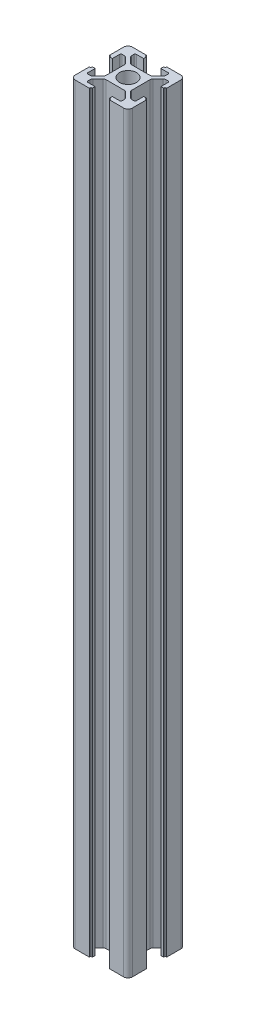
from build123d import *

# Parameters (mm, degrees)
BOSS_EXTRU_1_CORPS_DEPTH    = 263.5
CONG_1_R                    = 1.5
CONG_2_R                    = 0.4
CONG_4_R                    = 1
CONG_1_OF_SYM_TRIE_BRAS_R   = 1.5
CONG_2_OF_SYM_TRIE_BRAS_R   = 0.4
CONG_4_OF_SYM_TRIE_BRAS_R   = 1
SYM_TRIE_BRAS_DOUBLE_DEPTH  = 263.5
APR_S_TARODAGE_M6_R         = 3
ENL_V_MAT_FILETAGE_M6_DEPTH = 264.879233741


# Read off the part's stored shape, not the designer's step: Symétrie Bras double
with BuildPart() as part:
    # Esquisse4 → Boss.-Extru.1 Corps (new body)
    with BuildSketch(Plane(origin=(0, 0, 0), x_dir=(1, 0, 0), z_dir=(0, 1, 0))):
        Polygon((0, 0), (-4.5, 0), (-4.5, 3.625), (-6.875, 6), (-8.5, 6), (-8.5, 3), (-9.5, 3), (-9.5, 3.5), (-10, 3.5), (-10, 10), (-3.5, 10), (-3.5, 9.5), (-3, 9.5), (-3, 8.5), (-6, 8.5), (-6, 6.875), (-3.625, 4.5), (0, 4.5), align=None)
    boss_extru_1_corps = extrude(amount=BOSS_EXTRU_1_CORPS_DEPTH)

    # Congé1
    cong_1_edges = [part.edges().sort_by_distance(p)[0] for p in [
        (-10, 131.75, -10),
    ]]
    fillet(cong_1_edges, radius=CONG_1_R)

    # Congé2
    cong_2_edges = [part.edges().sort_by_distance(p)[0] for p in [
        (-8.5, 131.75, -6),
        (-6, 131.75, -8.5),
    ]]
    fillet(cong_2_edges, radius=CONG_2_R)

    # Congé4
    cong_4_edges = [part.edges().sort_by_distance(p)[0] for p in [
        (-4.5, 131.75, -3.625),
        (-6.875, 131.75, -6),
        (-6, 131.75, -6.875),
        (-3.625, 131.75, -4.5),
    ]]
    fillet(cong_4_edges, radius=CONG_4_R)

    # Symétrie Bras: Boss.-Extru.1 Corps across plane
    add(boss_extru_1_corps.mirror(Plane(origin=(0, 263.5, -4.5), x_dir=(0, 0, 1), z_dir=(-1, 0, 0))))

    # Congé1 of Symétrie Bras
    cong_1_of_sym_trie_bras_edges = [part.edges().sort_by_distance(p)[0] for p in [
        (10, 131.75, -10),
    ]]
    fillet(cong_1_of_sym_trie_bras_edges, radius=CONG_1_OF_SYM_TRIE_BRAS_R)

    # Congé2 of Symétrie Bras
    cong_2_of_sym_trie_bras_edges = [part.edges().sort_by_distance(p)[0] for p in [
        (8.5, 131.75, -6),
        (6, 131.75, -8.5),
    ]]
    fillet(cong_2_of_sym_trie_bras_edges, radius=CONG_2_OF_SYM_TRIE_BRAS_R)

    # Congé4 of Symétrie Bras
    cong_4_of_sym_trie_bras_edges = [part.edges().sort_by_distance(p)[0] for p in [
        (4.5, 131.75, -3.625),
        (6.875, 131.75, -6),
        (6, 131.75, -6.875),
        (3.625, 131.75, -4.5),
    ]]
    fillet(cong_4_of_sym_trie_bras_edges, radius=CONG_4_OF_SYM_TRIE_BRAS_R)

    # Symétrie Bras double outline → Symétrie Bras double (add)
    with BuildSketch(Plane(origin=(0, 0, 0), x_dir=(1, 0, 0), z_dir=(0, 1, 0))):
        with BuildLine():
            ThreePointArc((7.289213562, -6), (6.90653013, -5.923879533), (6.582106781, -5.707106781))
            Line((6.582106781, -5.707106781), (4.792893219, -3.917893219))
            ThreePointArc((4.792893219, -3.917893219), (4.576120467, -3.59346987), (4.5, -3.210786438))
            Line((4.5, -3.210786438), (4.5, 0))
            Line((4.5, 0), (-4.5, 0))
            Line((-4.5, 0), (-4.5, -3.210786438))
            ThreePointArc((-4.5, -3.210786438), (-4.576120467, -3.59346987), (-4.792893219, -3.917893219))
            Line((-4.792893219, -3.917893219), (-6.582106781, -5.707106781))
            ThreePointArc((-6.582106781, -5.707106781), (-6.90653013, -5.923879533), (-7.289213562, -6))
            Line((-7.289213562, -6), (-8.1, -6))
            ThreePointArc((-8.1, -6), (-8.382842712, -5.882842712), (-8.5, -5.6))
            Line((-8.5, -5.6), (-8.5, -3))
            Line((-8.5, -3), (-9.5, -3))
            Line((-9.5, -3), (-9.5, -3.5))
            Line((-9.5, -3.5), (-10, -3.5))
            Line((-10, -3.5), (-10, -8.5))
            ThreePointArc((-10, -8.5), (-9.560660172, -9.560660172), (-8.5, -10))
            Line((-8.5, -10), (-3.5, -10))
            Line((-3.5, -10), (-3.5, -9.5))
            Line((-3.5, -9.5), (-3, -9.5))
            Line((-3, -9.5), (-3, -8.5))
            Line((-3, -8.5), (-5.6, -8.5))
            ThreePointArc((-5.6, -8.5), (-5.882842712, -8.382842712), (-6, -8.1))
            Line((-6, -8.1), (-6, -7.289213562))
            ThreePointArc((-6, -7.289213562), (-5.923879533, -6.90653013), (-5.707106781, -6.582106781))
            Line((-5.707106781, -6.582106781), (-3.917893219, -4.792893219))
            ThreePointArc((-3.917893219, -4.792893219), (-3.59346987, -4.576120467), (-3.210786438, -4.5))
            Line((-3.210786438, -4.5), (3.210786438, -4.5))
            ThreePointArc((3.210786438, -4.5), (3.59346987, -4.576120467), (3.917893219, -4.792893219))
            Line((3.917893219, -4.792893219), (5.707106781, -6.582106781))
            ThreePointArc((5.707106781, -6.582106781), (5.923879533, -6.90653013), (6, -7.289213562))
            Line((6, -7.289213562), (6, -8.1))
            ThreePointArc((6, -8.1), (5.882842712, -8.382842712), (5.6, -8.5))
            Line((5.6, -8.5), (3, -8.5))
            Line((3, -8.5), (3, -9.5))
            Line((3, -9.5), (3.5, -9.5))
            Line((3.5, -9.5), (3.5, -10))
            Line((3.5, -10), (8.5, -10))
            ThreePointArc((8.5, -10), (9.560660172, -9.560660172), (10, -8.5))
            Line((10, -8.5), (10, -3.5))
            Line((10, -3.5), (9.5, -3.5))
            Line((9.5, -3.5), (9.5, -3))
            Line((9.5, -3), (8.5, -3))
            Line((8.5, -3), (8.5, -5.6))
            ThreePointArc((8.5, -5.6), (8.382842712, -5.882842712), (8.1, -6))
            Line((8.1, -6), (7.289213562, -6))
        make_face()
    extrude(amount=SYM_TRIE_BRAS_DOUBLE_DEPTH)

    # Après tarodage M6 → Enlèv. mat.-Filetage M6 (cut, through all)
    with BuildSketch(Plane.XZ):
        with Locations(Location((0, 0, 0), (0, 0, 270))):
            Circle(APR_S_TARODAGE_M6_R)
    extrude(amount=-ENL_V_MAT_FILETAGE_M6_DEPTH, mode=Mode.SUBTRACT)


solid = part.part
